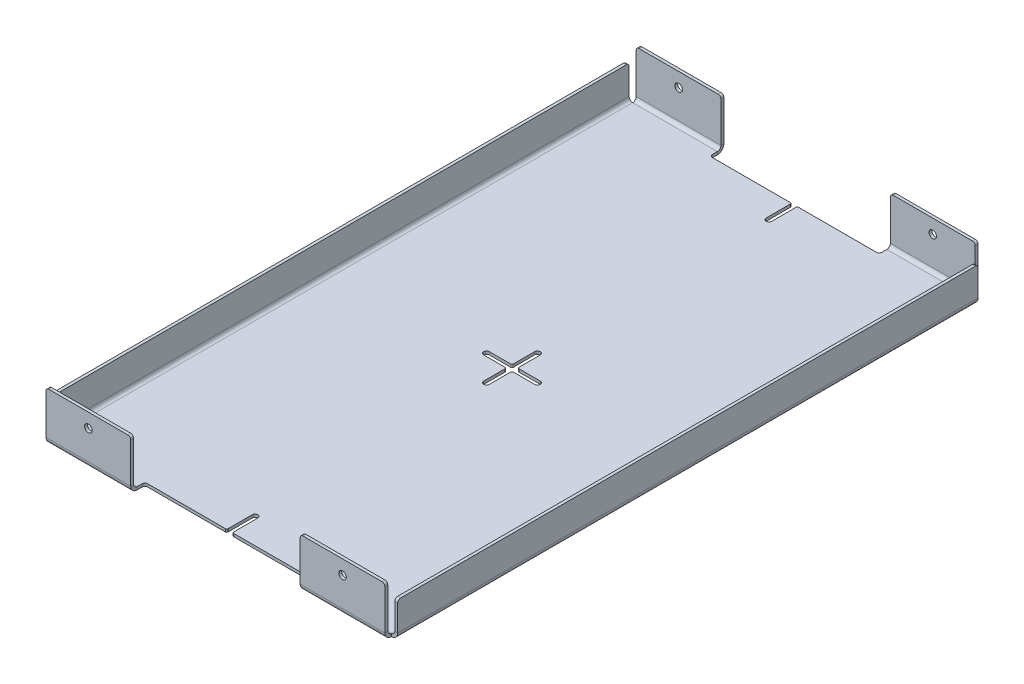
from build123d import *

# Parameters (mm, degrees)
BASE_FLANGE1_DEPTH      = 304.8
CUT_EXTRUDE1_DEPTH      = 408.166225608
CUT_EXTRUDE1_DEPTH_BACK = 408.166225608
SKETCH6_W               = 152.4
SKETCH6_H               = 12.7
EDGE_FLANGE1_DEPTH      = 521.87348
EDGE_FLANGE1_BEND_DEPTH = 521.87348
F_1_4_CLEARANCE_HOLE1_D = 6.7564
FILLET1_R               = 2.54
CUT_EXTRUDE2_DEPTH      = 412.498279143
CUT_EXTRUDE3_DEPTH      = 412.769633365
FILLET2_R               = 1.27


# Sheet-metal steps are written as plain solids
with BuildPart() as part:
    # Sketch1 → Base-Flange1 (new body)
    with BuildSketch(Plane(origin=(0, 0, 0), x_dir=(0, 0, -1), z_dir=(1, 0, 0))):
        with BuildLine():
            Line((-266.7, 44.45), (-266.7, 5.76326))
            ThreePointArc((-266.7, 5.76326), (-265.011980228, 1.688019772), (-260.93674, 0))
            Line((-260.93674, 0), (260.93674, 0))
            ThreePointArc((260.93674, 0), (265.011980228, 1.688019772), (266.7, 5.76326))
            Line((266.7, 5.76326), (266.7, 44.45))
            Line((266.7, 44.45), (264.11174, 44.45))
            Line((264.11174, 44.45), (264.11174, 5.76326))
            ThreePointArc((264.11174, 5.76326), (263.18180403, 3.51819597), (260.93674, 2.58826))
            Line((260.93674, 2.58826), (-260.93674, 2.58826))
            ThreePointArc((-260.93674, 2.58826), (-263.18180403, 3.51819597), (-264.11174, 5.76326))
            Line((-264.11174, 5.76326), (-264.11174, 44.45))
            Line((-264.11174, 44.45), (-266.7, 44.45))
        make_face()
    extrude(amount=BASE_FLANGE1_DEPTH)

    # Sketch6 → Cut-Extrude1 (cut, two sides: drawn at the far end of the back side and taken through both)
    with BuildSketch(Plane(origin=(0, 2.58826, 0), x_dir=(1, 0, 0), z_dir=(0, 1, 0)).offset(-CUT_EXTRUDE1_DEPTH_BACK)):
        with Locations((152.4, 260.35)):
            Rectangle(SKETCH6_W, SKETCH6_H)
        with Locations((152.4, -260.35)):
            Rectangle(SKETCH6_W, SKETCH6_H)
    extrude(amount=CUT_EXTRUDE1_DEPTH + CUT_EXTRUDE1_DEPTH_BACK, mode=Mode.SUBTRACT)

    # Edge-Flange1 section (across the edge) → Edge-Flange1 (add)
    with BuildSketch(Plane(origin=(-3.175, 2.58826, -260.93674), x_dir=(1, 0, 0), z_dir=(0, 0, 1))):
        with BuildLine():
            Line((-2.58826, 3.175), (-2.58826, 29.16174))
            Line((-2.58826, 29.16174), (0, 29.16174))
            Line((0, 29.16174), (0, 3.175))
            ThreePointArc((0, 3.175), (0.92993597, 0.92993597), (3.175, 0))
            Line((3.175, 0), (3.175, -2.58826))
            ThreePointArc((3.175, -2.58826), (-0.900240228, -0.900240228), (-2.58826, 3.175))
        make_face()
    extrude(amount=EDGE_FLANGE1_DEPTH)

    # Edge-Flange1 section 2 (across the edge) → Edge-Flange1 bend (add)
    with BuildSketch(Plane(origin=(307.975, 2.58826, 260.93674), x_dir=(-1, 0, 0), z_dir=(0, 0, -1))):
        with BuildLine():
            Line((-2.58826, 3.175), (-2.58826, 29.16174))
            Line((-2.58826, 29.16174), (0, 29.16174))
            Line((0, 29.16174), (0, 3.175))
            ThreePointArc((0, 3.175), (0.92993597, 0.92993597), (3.175, 0))
            Line((3.175, 0), (3.175, -2.58826))
            ThreePointArc((3.175, -2.58826), (-0.900240228, -0.900240228), (-2.58826, 3.175))
        make_face()
    extrude(amount=EDGE_FLANGE1_BEND_DEPTH)

    # 1/4 Clearance Hole1 (through all)
    with Locations(Plane.XY.offset(266.7)):
        with Locations((38.1, 31.75), (266.7, 31.75)):
            Hole(F_1_4_CLEARANCE_HOLE1_D / 2)

    # Fillet1
    fillet1_edges = [part.edges().sort_by_distance(p)[0] for p in [
        (0, 44.45, 265.40587),
        (-4.46913, 31.75, -260.93674),
        (-4.46913, 31.75, 260.93674),
        (0, 44.45, -265.40587),
        (309.26913, 31.75, 260.93674),
        (309.26913, 31.75, -260.93674),
        (304.8, 44.45, 265.40587),
        (76.2, 1.29413, -254),
        (228.6, 1.29413, -254),
        (228.6, 44.45, -265.40587),
        (76.2, 44.45, -265.40587),
        (304.8, 44.45, -265.40587),
        (228.6, 1.29413, 254),
        (76.2, 1.29413, 254),
        (76.2, 44.45, 265.40587),
        (228.6, 44.45, 265.40587),
    ]]
    fillet(fillet1_edges, radius=FILLET1_R)

    # Sketch15 → Cut-Extrude2 (cut, through all)
    with BuildSketch(Plane(origin=(0, 2.58826, 0), x_dir=(1, 0, 0), z_dir=(0, 1, 0))):
        with BuildLine():
            Line((149.86, 22.86), (149.86, 2.54))
            Line((149.86, 2.54), (129.54, 2.54))
            ThreePointArc((129.54, 2.54), (127, 0), (129.54, -2.54))
            Line((129.54, -2.54), (149.86, -2.54))
            Line((149.86, -2.54), (149.86, -22.86))
            ThreePointArc((149.86, -22.86), (152.4, -25.4), (154.94, -22.86))
            Line((154.94, -22.86), (154.94, -2.54))
            Line((154.94, -2.54), (175.26, -2.54))
            ThreePointArc((175.26, -2.54), (177.8, 0), (175.26, 2.54))
            Line((175.26, 2.54), (154.94, 2.54))
            Line((154.94, 2.54), (154.94, 22.86))
            ThreePointArc((154.94, 22.86), (152.4, 25.4), (149.86, 22.86))
        make_face()
    extrude(amount=-CUT_EXTRUDE2_DEPTH, mode=Mode.SUBTRACT)

    # Sketch16 → Cut-Extrude3 (cut, through all)
    with BuildSketch(Plane.XZ):
        with BuildLine():
            Line((149.86, -254), (149.86, -231.14))
            ThreePointArc((149.86, -231.14), (152.4, -228.6), (154.94, -231.14))
            Line((154.94, -231.14), (154.94, -254))
            Line((154.94, -254), (149.86, -254))
        make_face()
        with BuildLine():
            Line((154.94, 254), (149.86, 254))
            Line((149.86, 254), (149.86, 231.14))
            ThreePointArc((149.86, 231.14), (152.4, 228.6), (154.94, 231.14))
            Line((154.94, 231.14), (154.94, 254))
        make_face()
    extrude(amount=-CUT_EXTRUDE3_DEPTH, mode=Mode.SUBTRACT)

    # Fillet2
    fillet2_edges = [part.edges().sort_by_distance(p)[0] for p in [
        (149.86, 1.29413, -2.54),
        (154.94, 1.29413, -2.54),
        (154.94, 1.29413, 2.54),
        (149.86, 1.29413, 2.54),
        (154.94, 1.29413, 254),
        (149.86, 1.29413, 254),
        (154.94, 1.29413, -254),
        (149.86, 1.29413, -254),
    ]]
    fillet(fillet2_edges, radius=FILLET2_R)


solid = part.part
